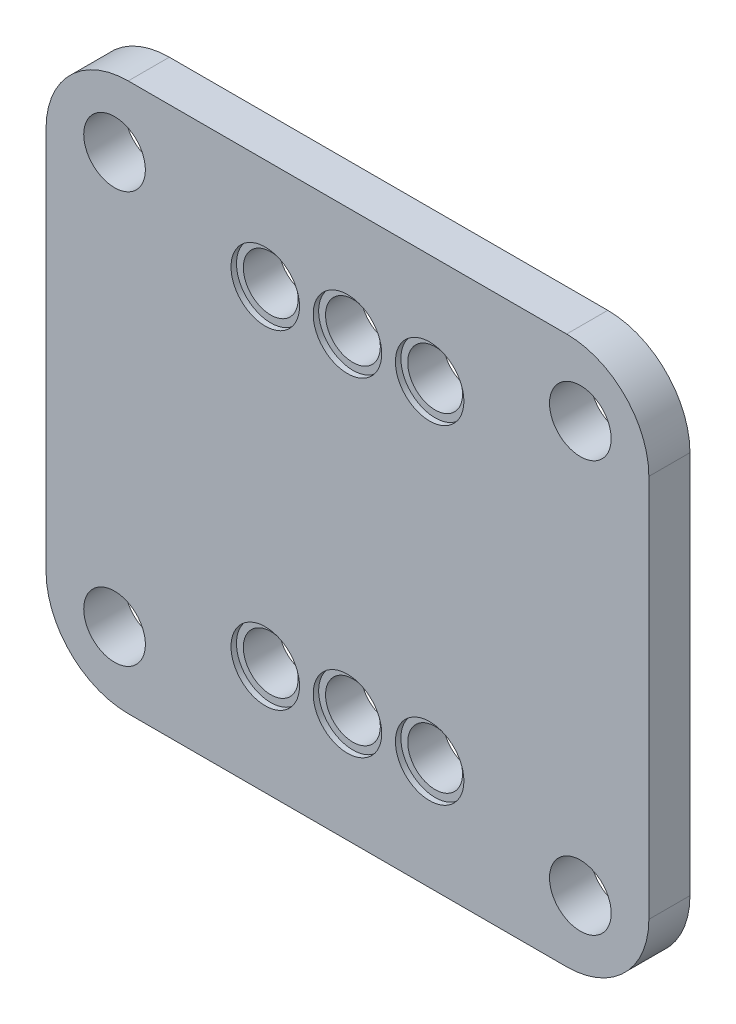
from build123d import *

# Parameters (mm, degrees)
ESQUISSE2_W                  = 44
ESQUISSE2_H                  = 40
BOSS_EXTRU_1_DEPTH           = 3
ENL_V_MAT_EXTRU_1_DEPTH      = 60.539902586
ENL_V_MAT_EXTRU_1_DEPTH_BACK = 60.539902586
ESQUISSE3_R                  = 2
ESQUISSE3_R_2                = 2.25
CONG_1_R                     = 6
ESQUISSE4_R                  = 2.5
ENL_V_MAT_EXTRU_2_DEPTH      = 0.4


with BuildPart() as part:
    # Esquisse2 → Boss.-Extru.1 (new body)
    with BuildSketch(Plane.XY):
        with Locations((22, 20)):
            Rectangle(ESQUISSE2_W, ESQUISSE2_H)
    extrude(amount=BOSS_EXTRU_1_DEPTH)

    # Esquisse3 → Enlèv. mat.-Extru.1 (cut, two sides: drawn at the far end of the back side and taken through both)
    with BuildSketch(Plane.XY.offset(3).offset(-ENL_V_MAT_EXTRU_1_DEPTH_BACK)):
        with Locations((22, 32)):
            Circle(ESQUISSE3_R)
        with Locations((16, 32)):
            Circle(ESQUISSE3_R)
        with Locations((28, 32)):
            Circle(ESQUISSE3_R)
        with Locations((28, 8)):
            Circle(ESQUISSE3_R)
        with Locations((16, 8)):
            Circle(ESQUISSE3_R)
        with Locations((22, 8)):
            Circle(ESQUISSE3_R)
        with Locations((5, 35)):
            Circle(ESQUISSE3_R_2)
        with Locations((5, 5)):
            Circle(ESQUISSE3_R_2)
        with Locations((39, 5)):
            Circle(ESQUISSE3_R_2)
        with Locations((39, 35)):
            Circle(ESQUISSE3_R_2)
    extrude(amount=ENL_V_MAT_EXTRU_1_DEPTH + ENL_V_MAT_EXTRU_1_DEPTH_BACK, mode=Mode.SUBTRACT)

    # Congé1
    cong_1_edges = [part.edges().sort_by_distance(p)[0] for p in [
        (0, 40, 1.5),
        (0, 0, 1.5),
        (44, 0, 1.5),
        (44, 40, 1.5),
    ]]
    fillet(cong_1_edges, radius=CONG_1_R)

    # Esquisse4 → Enlèv. mat.-Extru.2 (cut)
    with BuildSketch(Plane.XY.offset(3)):
        with Locations((16, 8)):
            Circle(ESQUISSE4_R)
        with Locations((22, 8)):
            Circle(ESQUISSE4_R)
        with Locations((28, 8)):
            Circle(ESQUISSE4_R)
        with Locations((28, 32)):
            Circle(ESQUISSE4_R)
        with Locations((22, 32)):
            Circle(ESQUISSE4_R)
        with Locations((16, 32)):
            Circle(ESQUISSE4_R)
    extrude(amount=-ENL_V_MAT_EXTRU_2_DEPTH, mode=Mode.SUBTRACT)


solid = part.part
